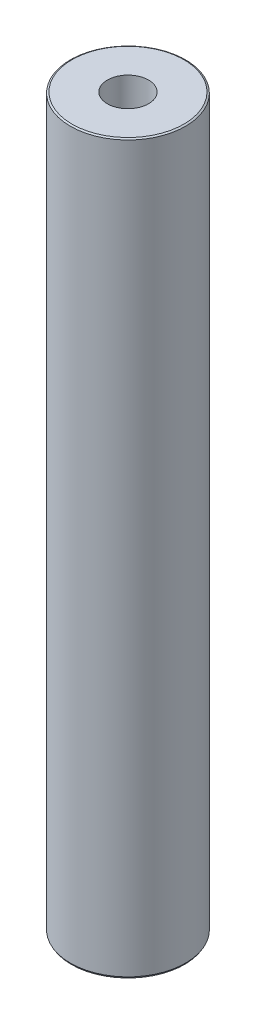
from build123d import *
from OCP.BRepFilletAPI import BRepFilletAPI_MakeChamfer

# Parameters (mm, degrees)
SKETCH1_R           = 47.5
BOSS_EXTRUDE1_DEPTH = 600
SKETCH2_R           = 17.009961565
CUT_EXTRUDE1_DEPTH  = 604.748706003
CHAMFER1_SIZE       = 0.796328808
CHAMFER1_SIZE2      = 1.379281955


with BuildPart() as part:
    # Sketch1 → Boss-Extrude1 (new body)
    with BuildSketch(Plane(origin=(0, 0, 0), x_dir=(1, 0, 0), z_dir=(0, 1, 0))):
        Circle(SKETCH1_R)
    extrude(amount=BOSS_EXTRUDE1_DEPTH)

    # Sketch2 → Cut-Extrude1 (cut, through all)
    with BuildSketch(Plane(origin=(0, 0, 0), x_dir=(1, 0, 0), z_dir=(0, 1, 0))):
        Circle(SKETCH2_R)
    extrude(amount=CUT_EXTRUDE1_DEPTH, mode=Mode.SUBTRACT)

    # Chamfer1: one chamfer whose edges measure the first distance from different faces: ONE call of the kernel's chamfer builder (chamfer() names one face for all edges)
    chamfer1_edges_1 = [part.edges().sort_by_distance(p)[0] for p in [
        (-47.5, 600, 0),
    ]]
    chamfer1_side_1 = [part.faces().sort_by_distance(p)[0] for p in [
        (-47.5, 300, 0),
    ]]
    chamfer1_edges_2 = [part.edges().sort_by_distance(p)[0] for p in [
        (-47.5, 0, 0),
    ]]
    chamfer1_side_2 = [part.faces().sort_by_distance(p)[0] for p in [
        (-46.156497116, 0, 0),
    ]]
    chamfer1 = BRepFilletAPI_MakeChamfer(part.part.solid().wrapped)
    for e in chamfer1_edges_1:
        chamfer1.Add(CHAMFER1_SIZE, CHAMFER1_SIZE2, e.wrapped, chamfer1_side_1[0].wrapped)  # the first distance lies on this face
    for e in chamfer1_edges_2:
        chamfer1.Add(CHAMFER1_SIZE, CHAMFER1_SIZE2, e.wrapped, chamfer1_side_2[0].wrapped)  # the first distance lies on this face
    add(Compound.cast(chamfer1.Shape()), mode=Mode.REPLACE)


solid = part.part
